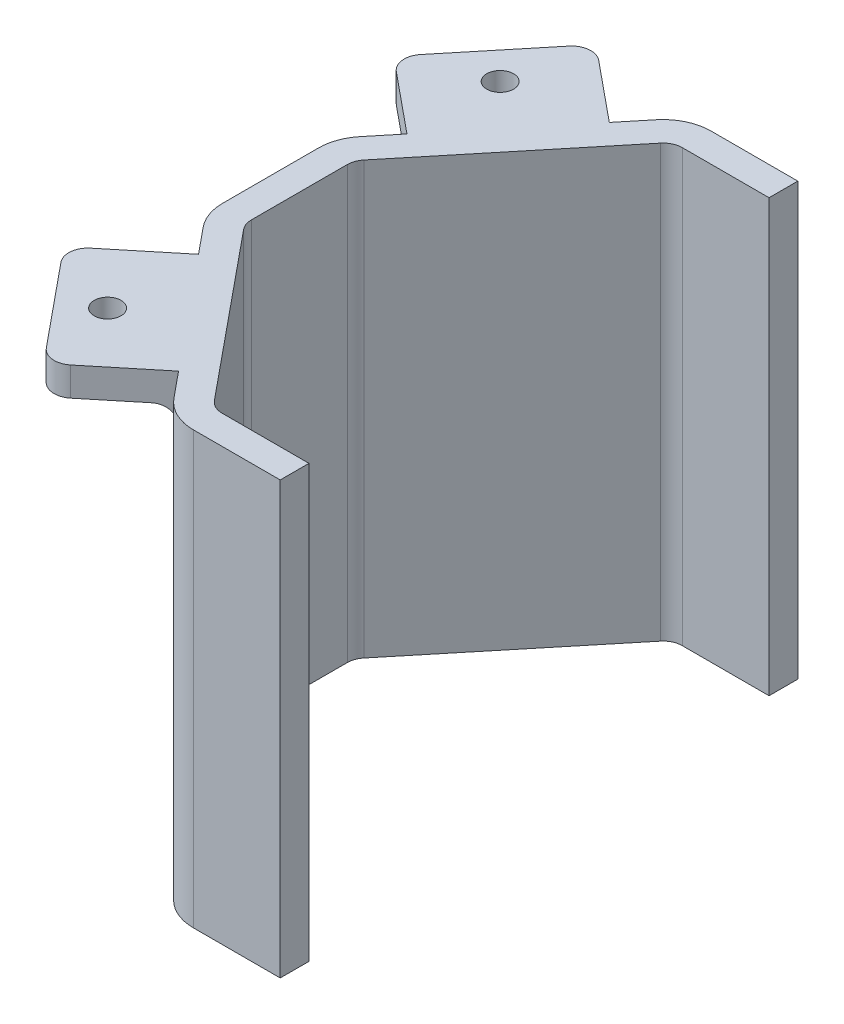
from build123d import *

# Parameters (mm, degrees)
BOSS_EXTRUDE1_DEPTH = 45
BOSS_EXTRUDE2_DEPTH = 3
FILLET1_R           = 2
SKETCH5_R           = 1.4
CUT_EXTRUDE1_DEPTH  = 65.13518801


with BuildPart() as part:
    # Sketch3 → Boss-Extrude1 (new body)
    with BuildSketch(Plane(origin=(0, 0, 0), x_dir=(1, 0, 0), z_dir=(0, 1, 0))):
        with BuildLine():
            Line((-8, 24), (-17.053839059, 24))
            ThreePointArc((-17.053839059, 24), (-17.90912017, 23.807897735), (-18.600099843, 23.268494221))
            Line((-18.600099843, 23.268494221), (-32.546260784, 6.268494221))
            ThreePointArc((-32.546260784, 6.268494221), (-32.883151822, 5.673601675), (-33, 5))
            Line((-33, 5), (-33, -5))
            ThreePointArc((-33, -5), (-32.883151822, -5.673601675), (-32.546260784, -6.268494221))
            Line((-32.546260784, -6.268494221), (-18.600099843, -23.268494221))
            ThreePointArc((-18.600099843, -23.268494221), (-17.90912017, -23.807897735), (-17.053839059, -24))
            Line((-17.053839059, -24), (-8, -24))
            Line((-8, -24), (-8, -27))
            Line((-8, -27), (-17.053839059, -27))
            ThreePointArc((-17.053839059, -27), (-19.192041837, -26.519744338), (-20.919491019, -25.171235552))
            Line((-20.919491019, -25.171235552), (-34.86565196, -8.171235552))
            ThreePointArc((-34.86565196, -8.171235552), (-35.707879555, -6.684004186), (-36, -5))
            Line((-36, -5), (-36, 5))
            ThreePointArc((-36, 5), (-35.707879555, 6.684004186), (-34.86565196, 8.171235552))
            Line((-34.86565196, 8.171235552), (-20.919491019, 25.171235552))
            ThreePointArc((-20.919491019, 25.171235552), (-19.192041837, 26.519744338), (-17.053839059, 27))
            Line((-17.053839059, 27), (-8, 27))
            Line((-8, 27), (-8, 24))
        make_face()
    extrude(amount=BOSS_EXTRUDE1_DEPTH)

    # Sketch4 → Boss-Extrude2 (add)
    with BuildSketch(Plane.XZ.offset(-45)):
        Polygon((-23.135718162, 22.469713492), (-30.867022082, 28.812184595), (-40.380728737, 17.215228715), (-32.649424817, 10.872757612), align=None)
        Polygon((-32.649424817, -10.872757612), (-40.380728737, -17.215228715), (-30.867022082, -28.812184595), (-23.135718162, -22.469713492), align=None)
    extrude(amount=BOSS_EXTRUDE2_DEPTH)

    # Fillet1
    fillet1_edges = [part.edges().sort_by_distance(p)[0] for p in [
        (-27.892571489, 42, -16.671235552),
        (-30.867022082, 43.5, -28.812184595),
        (-40.380728737, 43.5, -17.215228715),
        (-27.892571489, 42, 16.671235552),
        (-30.867022082, 43.5, 28.812184595),
        (-40.380728737, 43.5, 17.215228715),
    ]]
    fillet(fillet1_edges, radius=FILLET1_R)

    # Sketch5 → Cut-Extrude1 (cut, through all)
    with BuildSketch(Plane.XZ.offset(-42)):
        with Locations((-32.531353842, 20.476718214)):
            Circle(SKETCH5_R)
    cut_extrude1 = extrude(amount=-CUT_EXTRUDE1_DEPTH, mode=Mode.SUBTRACT)

    # Mirror1: Cut-Extrude1 across plane
    add(cut_extrude1.mirror(Plane.XY), mode=Mode.SUBTRACT)


solid = part.part
